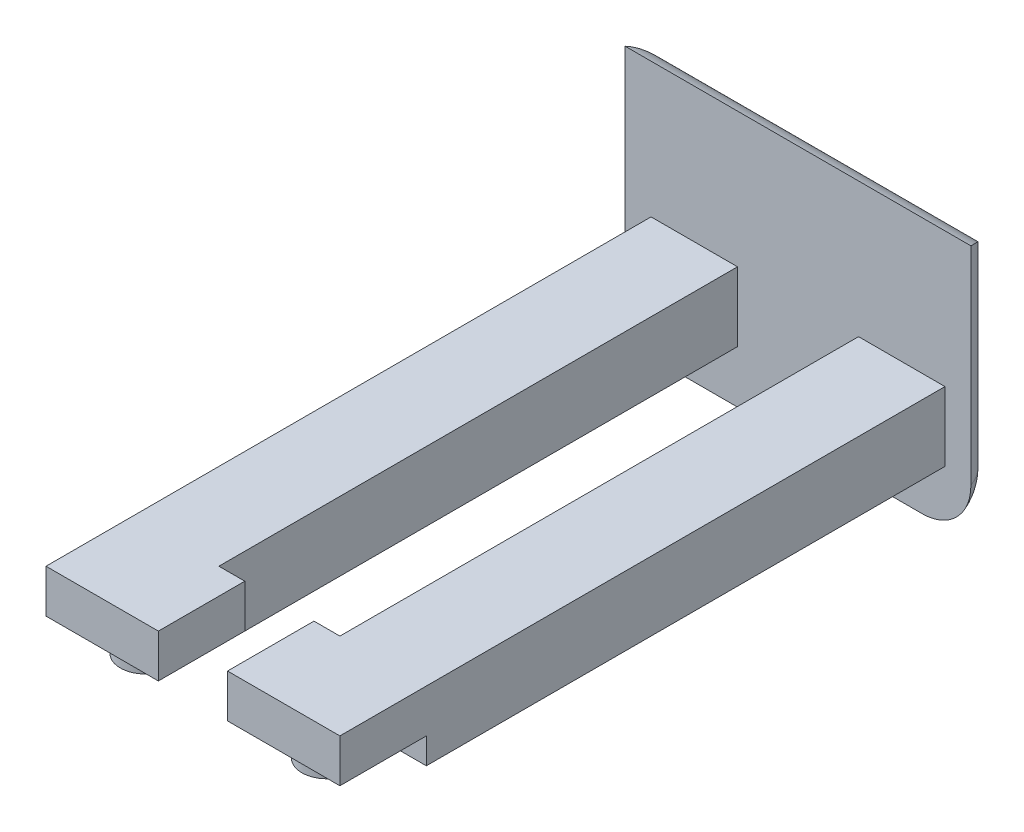
from build123d import *

# Parameters (mm, degrees)
SKETCH1_W           = 50.8
SKETCH1_H           = 38.1
BOSS_EXTRUDE1_DEPTH = 5.08
SKETCH2_W           = 16.51
SKETCH2_H           = 10.16
BOSS_EXTRUDE2_DEPTH = 76.2
SKETCH3_W           = 3.81
SKETCH3_H           = 10.16
CUT_EXTRUDE1_DEPTH  = 76.2
SKETCH4_W           = 16.51
SKETCH4_H           = 10.16
BOSS_EXTRUDE3_DEPTH = 12.7
SKETCH6_W           = 16.51
SKETCH6_H           = 12.7
CUT_EXTRUDE2_DEPTH  = 3.81
SKETCH5_R           = 3.683
BOSS_EXTRUDE4_DEPTH = 3.81
FILLET1_R           = 7.62
FILLET4_R           = 7.62
FILLET7_R           = 7.62


with BuildPart() as part:
    # Sketch1 → Boss-Extrude1 (new body)
    with BuildSketch(Plane.XY):
        Rectangle(SKETCH1_W, SKETCH1_H)
    extrude(amount=BOSS_EXTRUDE1_DEPTH)

    # Sketch2 → Boss-Extrude2 (add)
    with BuildSketch(Plane.XY.offset(5.08)):
        with Locations((-13.335, -5.842)):
            Rectangle(SKETCH2_W, SKETCH2_H)
        with Locations((13.335, -5.842)):
            Rectangle(SKETCH2_W, SKETCH2_H)
    extrude(amount=BOSS_EXTRUDE2_DEPTH)

    # Sketch3 → Cut-Extrude1 (cut)
    with BuildSketch(Plane.XY.offset(81.28)):
        with Locations((-6.985, -5.842)):
            Rectangle(SKETCH3_W, SKETCH3_H)
        with Locations((6.985, -5.842)):
            Rectangle(SKETCH3_W, SKETCH3_H)
    extrude(amount=-CUT_EXTRUDE1_DEPTH, mode=Mode.SUBTRACT)

    # Sketch4 → Boss-Extrude3 (add)
    with BuildSketch(Plane.XY.offset(81.28)):
        with Locations((-13.335, -5.842)):
            Rectangle(SKETCH4_W, SKETCH4_H)
        with Locations((13.335, -5.842)):
            Rectangle(SKETCH4_W, SKETCH4_H)
    extrude(amount=BOSS_EXTRUDE3_DEPTH)

    # Sketch6 → Cut-Extrude2 (cut)
    with BuildSketch(Plane.XZ.offset(10.922)):
        with Locations((-13.335, 87.63)):
            Rectangle(SKETCH6_W, SKETCH6_H)
        with Locations((13.335, 87.63)):
            Rectangle(SKETCH6_W, SKETCH6_H)
    extrude(amount=-CUT_EXTRUDE2_DEPTH, mode=Mode.SUBTRACT)

    # Sketch5 → Boss-Extrude4 (add)
    with BuildSketch(Plane.XZ.offset(10.922)):
        with Locations(Location((-13.335, 87.63, 0), (0, 0, 270))):
            Circle(SKETCH5_R)
        with Locations(Location((13.335, 87.63, 0), (0, 0, 270))):
            Circle(SKETCH5_R)
    extrude(amount=-BOSS_EXTRUDE4_DEPTH)

    # Fillet1
    # the kernel refuses this fillet: 7.62 mm, written as the material it takes off along each edge
    with BuildSketch(Plane(origin=(-43.360512242, 19.05, 0), x_dir=(0, -1, 0), z_dir=(1, 0, 0))) as fillet1_piece_1:
        with BuildLine():
            CenterArc((7.184204897, -7.62), FILLET1_R, 90, 70.528779366)
            Line((0, -5.08), (-0.143684098, -5.0292))
            ThreePointArc((-0.143684098, -5.0292), (-0.1524, -2.54), (-0.1524, 0))
            Line((-0.1524, 0), (0, 0.1524))
            Line((0, 0.1524), (7.184204897, 0.1524))
            Line((7.184204897, 0.1524), (7.184204897, 0))
        make_face()
    extrude(amount=86.721024484, mode=Mode.SUBTRACT)

    # Fillet4
    # the kernel refuses this fillet: 7.62 mm, written as the material it takes off along each edge
    with BuildSketch(Plane(origin=(-25.4, -37.010512242, 0), x_dir=(0, 0, 1), z_dir=(0, 1, 0)), Plane(origin=(25.4, 29.826307345, 0), x_dir=(0, 0, 1), z_dir=(0, -1, 0))) as fillet4_piece_1:
        with BuildLine():
            CenterArc((7.62, 7.184204897), FILLET4_R, 180, 70.528779366)
            Line((0, 7.184204897), (-0.1524, 7.184204897))
            Line((-0.1524, 7.184204897), (-0.1524, 0))
            Line((-0.1524, 0), (0, -0.1524))
            ThreePointArc((0, -0.1524), (2.54, -0.1524), (5.0292, -0.143684098))
            Line((5.0292, -0.143684098), (5.08, 0))
        make_face()
    extrude(amount=66.836819587, mode=Mode.SUBTRACT)

    # Fillet7
    # the kernel refuses this fillet: 7.62 mm, written as the material it takes off along each edge
    with BuildSketch(Plane(origin=(-18.215795103, -19.05, 7.62), x_dir=(0.5563472554155052, 0, 0.8309498970405103), z_dir=(0.8309498970405103, 0, -0.5563472554155052))) as fillet7_piece_1:
        with BuildLine():
            CenterArc((7.62 - FILLET7_R, -FILLET7_R), FILLET7_R, 0, 90)
            Line((7.62, -FILLET7_R), (7.62, 0))
            Line((7.62, 0), (7.62 - FILLET7_R, 0))
        make_face()
    revolve(axis=Axis((-18.215795103, -19.05, 7.62), (0, -1, 0)), revolution_arc=213.803560609, mode=Mode.SUBTRACT)
    with BuildSketch(Plane(origin=(18.215795103, -19.05, 7.62), x_dir=(-0.5563472554155037, 0, 0.8309498970405114), z_dir=(-0.8309498970405114, 0, -0.5563472554155037))) as fillet7_piece_2:
        with BuildLine():
            CenterArc((7.62 - FILLET7_R, FILLET7_R), FILLET7_R, 270, 90)
            Line((7.62, FILLET7_R), (7.62, 0))
            Line((7.62, 0), (7.62 - FILLET7_R, 0))
        make_face()
    revolve(axis=Axis((18.215795103, -19.05, 7.62), (0, 1, 0)), revolution_arc=213.803560609, mode=Mode.SUBTRACT)
    with BuildSketch(Plane(origin=(18.215795103, -19.05, 0), x_dir=(0, 0, 1), z_dir=(-1, 0, 0))) as fillet7_piece_3:
        with BuildLine():
            CenterArc((FILLET7_R, FILLET7_R), FILLET7_R, 180, 90)
            Line((0, FILLET7_R), (0, 0))
            Line((0, 0), (FILLET7_R, 0))
        make_face()
    extrude(amount=36.431590206, mode=Mode.SUBTRACT)


solid = part.part
